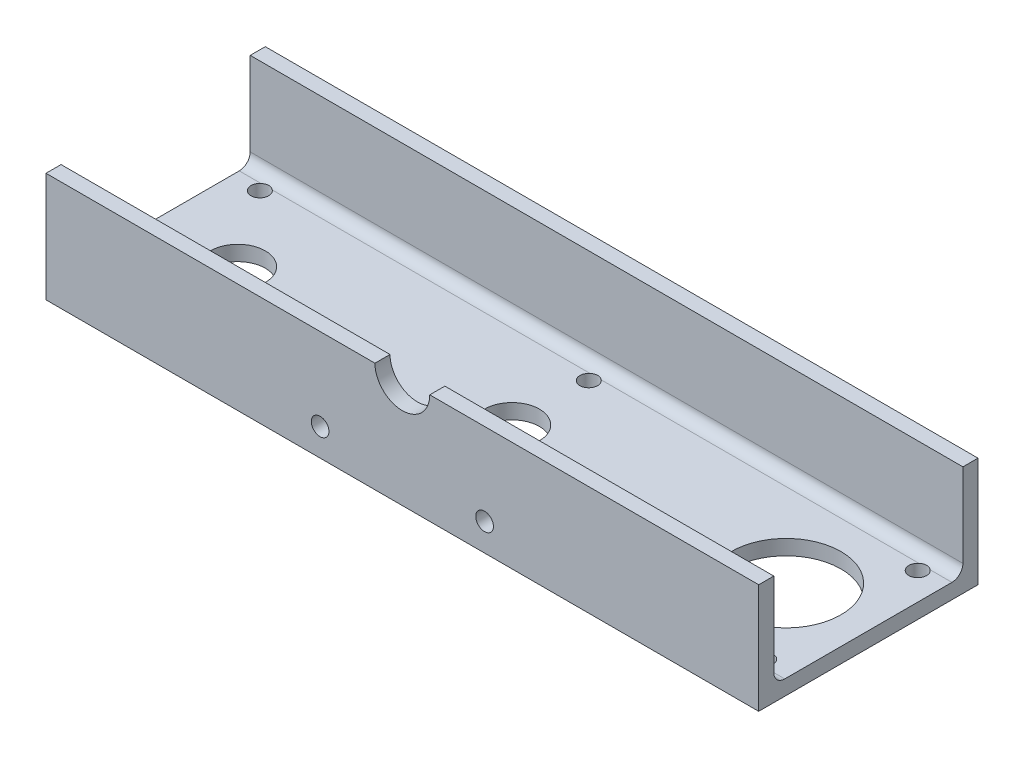
from build123d import *

# Parameters (mm, degrees)
BOSS_EXTRUDE1_DEPTH = 165.1
SKETCH2_R           = 12.7
CUT_EXTRUDE1_DEPTH  = 11.938
CUT_EXTRUDE2_DEPTH  = 9.398
SKETCH4_R           = 6.35
CUT_EXTRUDE3_DEPTH  = 6.35
SKETCH5_R           = 2.05
CUT_EXTRUDE4_DEPTH  = 6.35
SKETCH6_R           = 2.05
CUT_EXTRUDE5_DEPTH  = 6.35


with BuildPart() as part:
    # Sketch1 → Boss-Extrude1 (new body)
    with BuildSketch(Plane(origin=(0, 0, 0), x_dir=(0, 0, -1), z_dir=(1, 0, 0))):
        with BuildLine():
            Line((-21.9075, -6.6675), (-21.9075, 9.2075))
            Line((-21.9075, 9.2075), (-21.9075, 12.7))
            Line((-21.9075, 12.7), (-25.4, 12.7))
            Line((-25.4, 12.7), (-25.4, -12.7))
            Line((-25.4, -12.7), (25.4, -12.7))
            Line((25.4, -12.7), (25.4, 12.7))
            Line((25.4, 12.7), (21.9075, 12.7))
            Line((21.9075, 12.7), (21.9075, 9.2075))
            Line((21.9075, 9.2075), (21.9075, -6.6675))
            ThreePointArc((21.9075, -6.6675), (21.163551224, -8.463551224), (19.3675, -9.2075))
            Line((19.3675, -9.2075), (-19.3675, -9.2075))
            ThreePointArc((-19.3675, -9.2075), (-21.163551224, -8.463551224), (-21.9075, -6.6675))
        make_face()
    extrude(amount=-BOSS_EXTRUDE1_DEPTH)

    # Sketch2 → Cut-Extrude1 (cut)
    with BuildSketch(Plane.XZ.offset(12.7)):
        with Locations((-19.05, 0)):
            Circle(SKETCH2_R)
    extrude(amount=-CUT_EXTRUDE1_DEPTH, mode=Mode.SUBTRACT)

    # Sketch3 → Cut-Extrude2 (cut)
    with BuildSketch(Plane.XY.offset(25.4)):
        with BuildLine():
            ThreePointArc((-88.9, 12.7), (-82.55, 6.35), (-76.2, 12.7))
            Line((-76.2, 12.7), (-88.9, 12.7))
        make_face()
    extrude(amount=-CUT_EXTRUDE2_DEPTH, mode=Mode.SUBTRACT)

    # Sketch4 → Cut-Extrude3 (cut)
    with BuildSketch(Plane.XZ.offset(12.7)):
        with Locations((-82.55, 0)):
            Circle(SKETCH4_R)
        with Locations((-146.05, 0)):
            Circle(SKETCH4_R)
    extrude(amount=-CUT_EXTRUDE3_DEPTH, mode=Mode.SUBTRACT)

    # Sketch5 → Cut-Extrude4 (cut)
    with BuildSketch(Plane.XZ.offset(12.7)):
        with Locations((-6.35, -17.78)):
            Circle(SKETCH5_R)
        with Locations((-6.35, 17.78)):
            Circle(SKETCH5_R)
        with Locations((-82.55, 17.78)):
            Circle(SKETCH5_R)
        with Locations((-82.55, -17.78)):
            Circle(SKETCH5_R)
        with Locations((-158.75, 17.78)):
            Circle(SKETCH5_R)
        with Locations((-158.75, -17.78)):
            Circle(SKETCH5_R)
    extrude(amount=-CUT_EXTRUDE4_DEPTH, mode=Mode.SUBTRACT)

    # Sketch6 → Cut-Extrude5 (cut)
    with BuildSketch(Plane.XY.offset(25.4)):
        with Locations((-101.6, -6.35)):
            Circle(SKETCH6_R)
        with Locations((-63.5, -6.35)):
            Circle(SKETCH6_R)
    extrude(amount=-CUT_EXTRUDE5_DEPTH, mode=Mode.SUBTRACT)


solid = part.part
